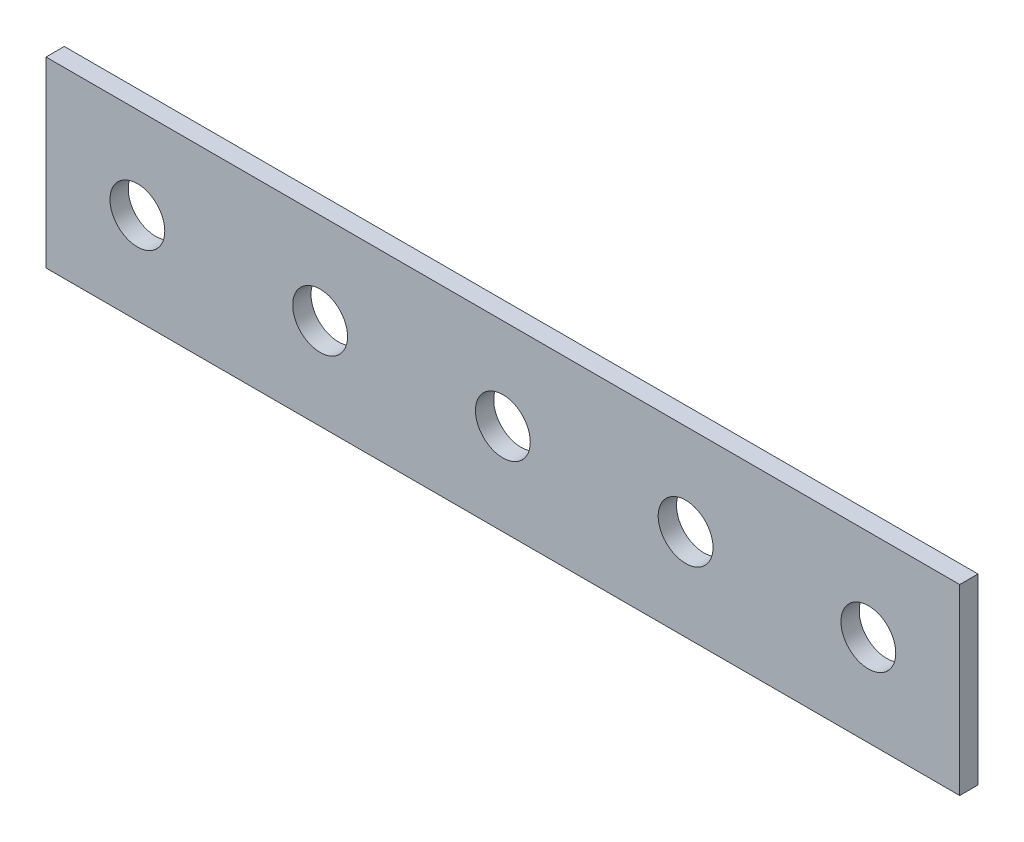
from build123d import *

# Parameters (mm, degrees)
ESQUISSE1_W           = 50
ESQUISSE1_H           = 10
MAIN_DEPTH            = 1
ESQUISSE2_R           = 1.5
HOLE_DEPTH            = 52
REPEATHOLERIGHT_COUNT = 3
REPEATHOLERIGHT_PITCH = 10
REPEATHOLELEFT_COUNT  = 3
REPEATHOLELEFT_PITCH  = 10


with BuildPart() as part:
    # Esquisse1 → Main (new body)
    with BuildSketch(Plane.XY):
        with Locations((25, 5)):
            Rectangle(ESQUISSE1_W, ESQUISSE1_H)
    extrude(amount=MAIN_DEPTH)

    # Esquisse2 → Hole (cut, through all)
    with BuildSketch(Plane.XY.offset(1)):
        with Locations((25, 5)):
            Circle(ESQUISSE2_R)
    hole = extrude(amount=-HOLE_DEPTH, mode=Mode.SUBTRACT)

    # RepeatHoleRight: Hole ×3
    with Locations(*[(i * REPEATHOLERIGHT_PITCH, 0, 0) for i in range(1, REPEATHOLERIGHT_COUNT)]):
        add(hole, mode=Mode.SUBTRACT)

    # RepeatHoleLeft: Hole ×3
    with Locations(*[(-i * REPEATHOLELEFT_PITCH, 0, 0) for i in range(1, REPEATHOLELEFT_COUNT)]):
        add(hole, mode=Mode.SUBTRACT)


solid = part.part
